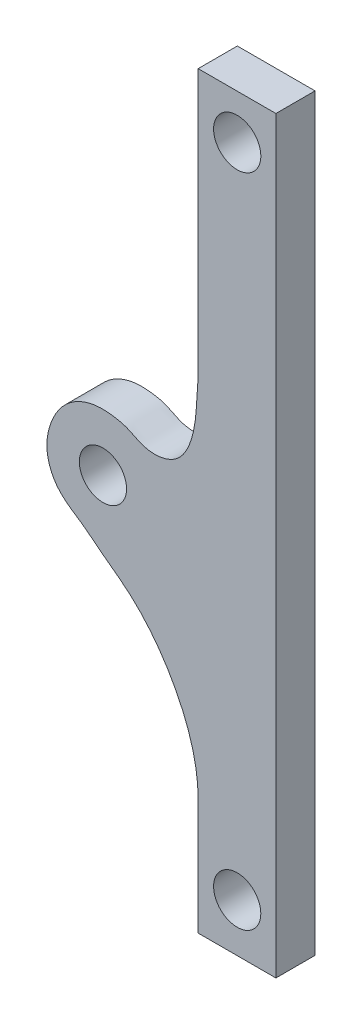
from build123d import *

# Parameters (mm, degrees)
SCHIZZO1_R                   = 1.525
ESTRUSIONE_ESTRUSIONE1_DEPTH = 2.53
FORO1_OUTLINE_R              = 1.525
FORO1_DEPTH                  = 2.53


# Read off the part's stored shape, not the designer's step: Foro1
with BuildPart() as part:
    # Schizzo1 → Estrusione-Estrusione1 (new body)
    with BuildSketch(Plane.XY):
        with BuildLine():
            Line((19.344160128, 2.398549361), (19.344160128, 50.758549361))
            Line((19.344160128, 50.758549361), (14.324160128, 50.758549361))
            Line((14.324160128, 50.758549361), (14.324160128, 33.561123443))
            add(Edge.make_bspline(
                [(14.324160128, 9.852536517), (14.329457987, 11.817161621), (13.211895499, 15.314671374), (10.522743691, 18.848719159), (8.133261932, 20.487633555), (6.784543218, 21.63222677), (5.343788341, 22.455699212), (4.348158318, 24.27709897), (4.704770463, 26.412742482), (5.979669362, 28.110436622), (7.489962297, 28.669291236), (8.735881946, 28.611365395), (9.72355423, 28.43270848), (10.565087326, 27.911809633), (11.714510715, 27.680317465), (12.976776108, 28.065540238), (14.318236653, 30.146680578), (14.188406963, 32.145084812), (14.324160128, 33.561123443)],
                knots=[0, 0, 0, 0, 0.165877522, 0.310250801, 0.370355979, 0.413778476, 0.462189974, 0.510332351, 0.581700784, 0.634410755, 0.686591696, 0.711498907, 0.741308267, 0.771463135, 0.795069043, 0.840627944, 0.873607157, 1, 1, 1, 1], degree=3))
            Line((14.324160128, 9.852536517), (14.324160128, 2.398549361))
            Line((14.324160128, 2.398549361), (19.344160128, 2.398549361))
        make_face()
        with Locations((16.844857247, 5.512496703)):
            Circle(SCHIZZO1_R, mode=Mode.SUBTRACT)
        with Locations((8.174532934, 24.935486701)):
            Circle(SCHIZZO1_R, mode=Mode.SUBTRACT)
    extrude(amount=ESTRUSIONE_ESTRUSIONE1_DEPTH)

    # Foro1 outline → Foro1 (cut)
    with BuildSketch(Plane.XY):
        with Locations((16.844857247, 47.886069837)):
            Circle(FORO1_OUTLINE_R)
    extrude(amount=FORO1_DEPTH, mode=Mode.SUBTRACT)


solid = part.part
